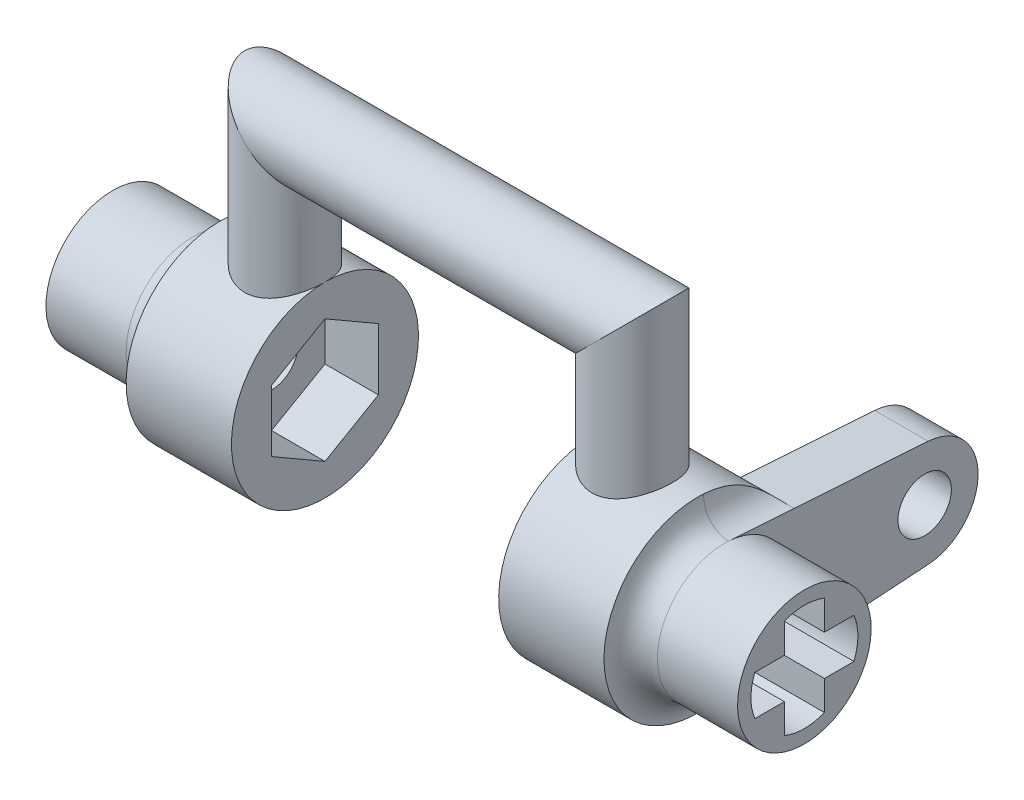
from build123d import *

# Parameters (mm, degrees)
SWEEP_1_PROFILE_R        = 1.5
EXTRUDE_1_DEPTH          = 3.44
EXTRUDE_1_DEPTH_BACK     = 4.5
EXTRUDE_1_START          = 9.5
SKETCH_8_R               = 2.5
EXTRUDE_2_DEPTH          = 4.5
EXTRUDE_2_DEPTH_BACK     = 3.44
EXTRUDE_2_START          = -9.5
SKETCH_9_R               = 2.5
EXTRUDE_START            = 9.94
SKETCH_14_R              = 1
EXTRUDE_3_DEPTH          = 2
CUT_EXTRUDE_START        = 12.94
CUT_EXTRUDE_1_DEPTH      = 4
CUT_EXTRUDE_START_2      = -8.94
CUT_EXTRUDE_2_DEPTH      = 4
SKETCH_16_R              = 0.25
CUT_EXTRUDE_3_DEPTH      = 0.25
CUT_EXTRUDE_START_3      = 8.69
SKETCH_17_R              = 0.25
CUT_EXTRUDE_4_DEPTH      = 0.25
EXTRUDE_START_2          = 5
SKETCH_18_R              = 3.5
EXTRUDE_4_DEPTH          = 3.94
EXTRUDE_START_3          = -8.94
SKETCH_20_R              = 3.5
EXTRUDE_5_DEPTH          = 3.94
CUT_EXTRUDE_6_DEPTH      = 19.653246417
CUT_EXTRUDE_6_DEPTH_BACK = 19.653246417
SKETCH_25_R              = 1
FILLET_1_R               = 1
CUT_EXTRUDE_START_4      = -5
CUT_EXTRUDE_7_DEPTH      = 2
CUT_EXTRUDE_START_5      = 5
CUT_EXTRUDE_8_DEPTH      = 2


with BuildPart() as part:
    # 扫描1: sweep along a path in 草图1
    with BuildLine(Plane.XY) as sweep_1_path:
        Line((9.5, 0), (6.5, 0))
        Line((6.5, 0), (6.5, 8))
        Line((6.5, 8), (-6.5, 8))
        Line((-6.5, 8), (-6.5, 0))
        Line((-6.5, 0), (-9.5, 0))
    # 扫描1 profile (on start of the path) → 扫描1 (sweep)
    with BuildSketch(Plane(origin=(9.5, 0, 0), x_dir=(0, -1, 0), z_dir=(-1, 0, 0))):
        Circle(SWEEP_1_PROFILE_R)
    sweep(path=sweep_1_path.line, transition=Transition.RIGHT)

    # 草图8 → 凸台-拉伸1 (add, two sides: drawn at the far end of the back side and taken through both)
    with BuildSketch(Plane(origin=(0, 0, 0), x_dir=(0, 0, -1), z_dir=(1, 0, 0)).offset(EXTRUDE_1_START - EXTRUDE_1_DEPTH_BACK)):
        with Locations(Location((0, 0, 0), (0, 0, 90))):
            Circle(SKETCH_8_R)
    extrude(amount=EXTRUDE_1_DEPTH + EXTRUDE_1_DEPTH_BACK)

    # 草图9 → 凸台-拉伸2 (add, two sides: drawn at the far end of the back side and taken through both)
    with BuildSketch(Plane(origin=(0, 0, 0), x_dir=(0, 0, -1), z_dir=(1, 0, 0)).offset(EXTRUDE_2_START - EXTRUDE_2_DEPTH_BACK)):
        with Locations(Location((0, 0, 0), (0, 0, 90))):
            Circle(SKETCH_9_R)
    extrude(amount=EXTRUDE_2_DEPTH + EXTRUDE_2_DEPTH_BACK)

    # 草图14 → 凸台-拉伸3 (add)
    with BuildSketch(Plane(origin=(0, 0, 0), x_dir=(0, 0, -1), z_dir=(1, 0, 0)).offset(EXTRUDE_START)):
        with BuildLine():
            Line((0.166666667, 2.494438258), (7.633333333, 1.995550606))
            ThreePointArc((7.633333333, 1.995550606), (9.5, 0), (7.633333333, -1.995550606))
            Line((7.633333333, -1.995550606), (0.166666667, -2.494438258))
            ThreePointArc((0.166666667, -2.494438258), (-2.5, 0), (0.166666667, 2.494438258))
        make_face()
        with Locations((7.5, 0)):
            Circle(SKETCH_14_R, mode=Mode.SUBTRACT)
    extrude(amount=-EXTRUDE_3_DEPTH)

    # 草图10 → 切除-拉伸1 (cut)
    with BuildSketch(Plane(origin=(0, 0, 0), x_dir=(0, 0, -1), z_dir=(1, 0, 0)).offset(CUT_EXTRUDE_START)):
        with BuildLine():
            Line((0.75, 0.75), (1.854049622, 0.75))
            ThreePointArc((1.854049622, 0.75), (2, 0), (1.854049622, -0.75))
            Line((1.854049622, -0.75), (0.75, -0.75))
            Line((0.75, -0.75), (0.75, -1.854049622))
            ThreePointArc((0.75, -1.854049622), (0, -2), (-0.75, -1.854049622))
            Line((-0.75, -1.854049622), (-0.75, -0.75))
            Line((-0.75, -0.75), (-1.854049622, -0.75))
            ThreePointArc((-1.854049622, -0.75), (-2, 0), (-1.854049622, 0.75))
            Line((-1.854049622, 0.75), (-0.75, 0.75))
            Line((-0.75, 0.75), (-0.75, 1.854049622))
            ThreePointArc((-0.75, 1.854049622), (0, 2), (0.75, 1.854049622))
            Line((0.75, 1.854049622), (0.75, 0.75))
        make_face()
    extrude(amount=-CUT_EXTRUDE_1_DEPTH, mode=Mode.SUBTRACT)

    # 草图11 → 切除-拉伸2 (cut)
    with BuildSketch(Plane(origin=(0, 0, 0), x_dir=(0, 0, -1), z_dir=(1, 0, 0)).offset(CUT_EXTRUDE_START_2)):
        with BuildLine():
            Line((0.75, 0.75), (0.75, 1.854049622))
            ThreePointArc((0.75, 1.854049622), (0, 2), (-0.75, 1.854049622))
            Line((-0.75, 1.854049622), (-0.75, 0.75))
            Line((-0.75, 0.75), (-1.854049622, 0.75))
            ThreePointArc((-1.854049622, 0.75), (-2, 0), (-1.854049622, -0.75))
            Line((-1.854049622, -0.75), (-0.75, -0.75))
            Line((-0.75, -0.75), (-0.75, -1.854049622))
            ThreePointArc((-0.75, -1.854049622), (0, -2), (0.75, -1.854049622))
            Line((0.75, -1.854049622), (0.75, -0.75))
            Line((0.75, -0.75), (1.854049622, -0.75))
            ThreePointArc((1.854049622, -0.75), (2, 0), (1.854049622, 0.75))
            Line((1.854049622, 0.75), (0.75, 0.75))
        make_face()
    extrude(amount=-CUT_EXTRUDE_2_DEPTH, mode=Mode.SUBTRACT)

    # 草图16 → 切除-拉伸3 (cut)
    with BuildSketch(Plane(origin=(0, 0, 0), x_dir=(0, 0, -1), z_dir=(1, 0, 0)).offset(CUT_EXTRUDE_START_2)):
        with Locations(Location((0.75, 0, 0), (0, 0, 90))):
            Circle(SKETCH_16_R)
    extrude(amount=CUT_EXTRUDE_3_DEPTH, mode=Mode.SUBTRACT)

    # 草图17 → 切除-拉伸4 (cut)
    with BuildSketch(Plane(origin=(0, 0, 0), x_dir=(0, 0, -1), z_dir=(1, 0, 0)).offset(CUT_EXTRUDE_START_3)):
        with Locations(Location((0.75, 0, 0), (0, 0, 90))):
            Circle(SKETCH_17_R)
    extrude(amount=CUT_EXTRUDE_4_DEPTH, mode=Mode.SUBTRACT)

    # 草图18 → 凸台-拉伸4 (add)
    with BuildSketch(Plane(origin=(0, 0, 0), x_dir=(0, 0, -1), z_dir=(1, 0, 0)).offset(EXTRUDE_START_2)):
        with Locations(Location((0, 0, 0), (0, 0, 90))):
            Circle(SKETCH_18_R)
    extrude(amount=EXTRUDE_4_DEPTH)

    # 草图20 → 凸台-拉伸5 (add)
    with BuildSketch(Plane(origin=(0, 0, 0), x_dir=(0, 0, -1), z_dir=(1, 0, 0)).offset(EXTRUDE_START_3)):
        with Locations(Location((0, 0, 0), (0, 0, 90))):
            Circle(SKETCH_20_R)
    extrude(amount=EXTRUDE_5_DEPTH)

    # 草图25 → 切除-拉伸6 (cut, two sides: drawn at the far end of the back side and taken through both)
    with BuildSketch(Plane(origin=(0, 0, 0), x_dir=(0, 0, -1), z_dir=(1, 0, 0)).offset(-CUT_EXTRUDE_6_DEPTH_BACK)):
        Circle(SKETCH_25_R)
    extrude(amount=CUT_EXTRUDE_6_DEPTH + CUT_EXTRUDE_6_DEPTH_BACK, mode=Mode.SUBTRACT)

    # 圆角1
    # the kernel refuses this fillet: 1 mm, written as the material it adds along each edge
    with BuildSketch(Plane(origin=(-8.94, 0, 0), x_dir=(0, 1, 0), z_dir=(0, 0, 1))) as fillet_1_piece_1:
        with BuildLine():
            CenterArc((2.5 + FILLET_1_R, FILLET_1_R), FILLET_1_R, 180, 90)
            Line((2.5, FILLET_1_R), (2.5, 0))
            Line((2.5, 0), (2.5 + FILLET_1_R, 0))
        make_face()
    revolve(axis=Axis((-8.94, 0, 0), (-1, 0, 0)))
    with BuildSketch(Plane(origin=(8.94, 0, 0), x_dir=(0, 1, 0), z_dir=(0, 0, -1))) as fillet_1_piece_2:
        with BuildLine():
            CenterArc((2.5 + FILLET_1_R, FILLET_1_R), FILLET_1_R, 180, 90)
            Line((2.5 + FILLET_1_R, 0), (2.5, 0))
            Line((2.5, 0), (2.5, FILLET_1_R))
        make_face()
    revolve(axis=Axis((8.94, 0, 0), (1, 0, 0)), revolution_arc=183.822553729)
    with BuildSketch(Plane(origin=(8.94, -2.494438258, -0.166666667), x_dir=(1, 0, 0), z_dir=(0, 0.06666666666666658, -0.9977753031397177))) as fillet_1_piece_3_section:
        with BuildLine():
            CenterArc((FILLET_1_R, FILLET_1_R), FILLET_1_R, 180, 90)
            Line((0, FILLET_1_R), (0, 0))
            Line((0, 0), (FILLET_1_R, 0))
        make_face()
    fillet_1_piece_3 = extrude(amount=4.949489743, mode=Mode.PRIVATE)
    fillet_1_piece_3 = fillet_1_piece_3 & Plane(origin=(9.184299624, 0, 0), x_dir=(0, 1, 0), z_dir=(-1, 0, 0)) * Cylinder(3.5, 14, mode=Mode.PRIVATE)
    add(fillet_1_piece_3)
    with BuildSketch(Plane(origin=(8.94, 2.164472275, -5.105145295), x_dir=(0, 0.9977753031397177, -0.0666666666666666), z_dir=(0, 0.06666666666666658, 0.9977753031397177))) as fillet_1_piece_4_section:
        with BuildLine():
            CenterArc((FILLET_1_R, -FILLET_1_R), FILLET_1_R, 90, 90)
            Line((0, -FILLET_1_R), (0, 0))
            Line((0, 0), (FILLET_1_R, 0))
        make_face()
    fillet_1_piece_4 = extrude(amount=4.949489743, mode=Mode.PRIVATE)
    fillet_1_piece_4 = fillet_1_piece_4 & Plane(origin=(9.184299625, 0, 0), x_dir=(0, 1, 0), z_dir=(-1, 0, 0)) * Cylinder(3.5, 14, mode=Mode.PRIVATE)
    add(fillet_1_piece_4)
    with BuildSketch(Plane(origin=(8.94, 0, 0), x_dir=(0, 0.9977753030864385, -0.06666666746407793), z_dir=(0, -0.06666666746407793, -0.9977753030864385))) as fillet_1_piece_5:
        with BuildLine():
            CenterArc((2.5 + FILLET_1_R, FILLET_1_R), FILLET_1_R, 180, 90)
            Line((2.5, FILLET_1_R), (2.5, 0))
            Line((2.5, 0), (2.5 + FILLET_1_R, 0))
        make_face()
    revolve(axis=Axis((8.94, 0, 0), (1, 0, 0)), revolution_arc=3.822553775)

    # 草图26 → 切除-拉伸7 (cut)
    with BuildSketch(Plane(origin=(0, 0, 0), x_dir=(0, 0, -1), z_dir=(1, 0, 0)).offset(CUT_EXTRUDE_START_4)):
        Polygon((0, -2.309401077), (2, -1.154700538), (2, 1.154700538), (0, 2.309401077), (-2, 1.154700538), (-2, -1.154700538), align=None)
    extrude(amount=-CUT_EXTRUDE_7_DEPTH, mode=Mode.SUBTRACT)

    # 草图27 → 切除-拉伸8 (cut)
    with BuildSketch(Plane(origin=(0, 0, 0), x_dir=(0, 0, -1), z_dir=(1, 0, 0)).offset(CUT_EXTRUDE_START_5)):
        Polygon((0, -2.309401077), (2, -1.154700538), (2, 1.154700538), (0, 2.309401077), (-2, 1.154700538), (-2, -1.154700538), align=None)
    extrude(amount=CUT_EXTRUDE_8_DEPTH, mode=Mode.SUBTRACT)


solid = part.part
